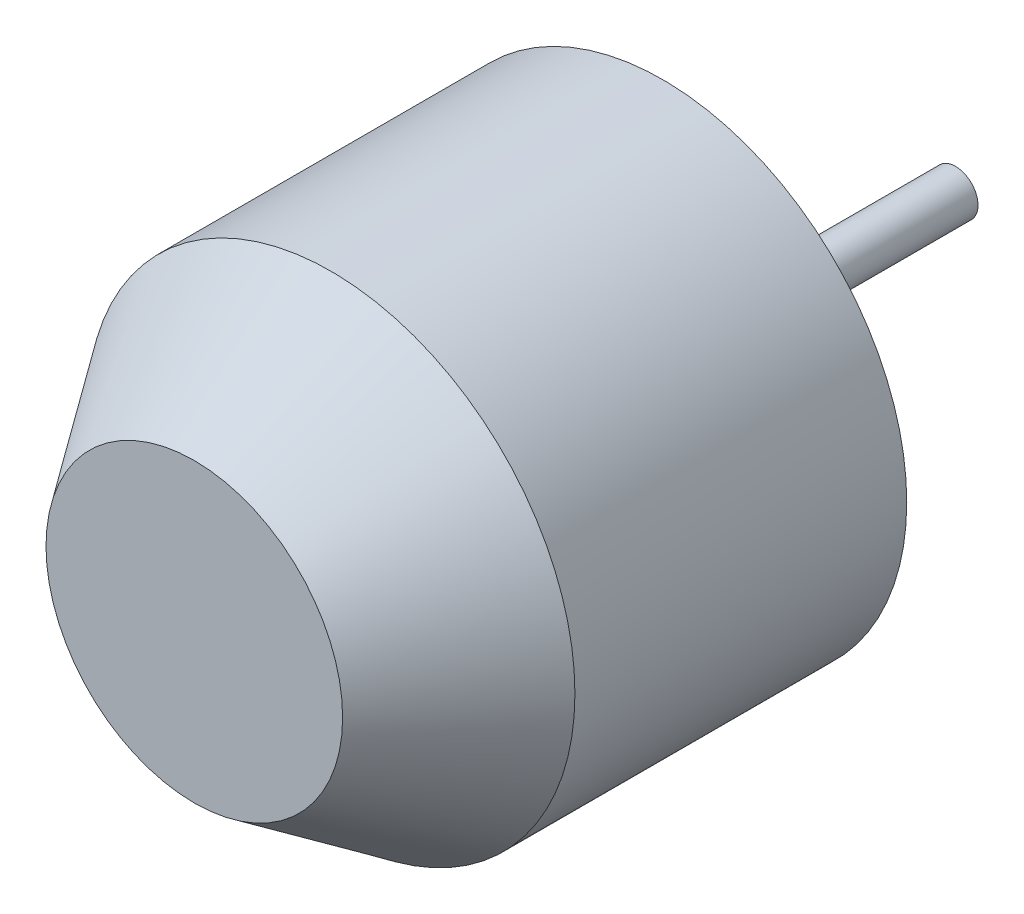
from build123d import *

# Parameters (mm, degrees)
ESQUISSE1_R             = 12.5
BOSS_EXTRU_1_DEPTH      = 17
ESQUISSE2_R             = 12.5
BOSS_EXTRU_2_DEPTH      = 7
BOSS_EXTRU_2_TAPER      = 35
ESQUISSE3_R             = 1.5
ENL_V_MAT_EXTRU_1_DEPTH = 10
CONG_1_SIZE             = 0.5
ESQUISSE4_R             = 3.5
BOSS_EXTRU_3_DEPTH      = 2
ESQUISSE5_R             = 1.15
BOSS_EXTRU_4_DEPTH      = 13


with BuildPart() as part:
    # Esquisse1 → Boss.-Extru.1 (new body)
    with BuildSketch(Plane.XY):
        Circle(ESQUISSE1_R)
    extrude(amount=BOSS_EXTRU_1_DEPTH)

    # Esquisse2 → Boss.-Extru.2 (add)
    with BuildSketch(Plane.XY.offset(17)):
        Circle(ESQUISSE2_R)
    extrude(amount=BOSS_EXTRU_2_DEPTH, taper=BOSS_EXTRU_2_TAPER)

    # Esquisse3 → Enlèv. mat.-Extru.1 (cut)
    with BuildSketch(Plane(origin=(0, 0, 0), x_dir=(-1, 0, 0), z_dir=(0, 0, -1))):
        with Locations((-8, 0)):
            Circle(ESQUISSE3_R)
        with Locations((8, 0)):
            Circle(ESQUISSE3_R)
    extrude(amount=-ENL_V_MAT_EXTRU_1_DEPTH, mode=Mode.SUBTRACT)

    # Congé1
    # a fillet whose section is not a circle: 0.5 mm, written as the material it takes off along each edge
    with BuildSketch(Plane(origin=(-8, 0, 0), x_dir=(-1, 0, 0), z_dir=(0, -1, 0))) as cong_1_piece_1:
        with BuildLine():
            Bezier((1.5 + CONG_1_SIZE, 0), (1.5, 0), (1.5, -CONG_1_SIZE), weights=[1, 0.035355339, 1])
            Line((1.5, -CONG_1_SIZE), (1.5, 0))
            Line((1.5, 0), (1.5 + CONG_1_SIZE, 0))
        make_face()
    revolve(axis=Axis((-8, 0, 0), (0, 0, -1)), mode=Mode.SUBTRACT)
    with BuildSketch(Plane(origin=(8, 0, 0), x_dir=(-1, 0, 0), z_dir=(0, -1, 0))) as cong_1_piece_2:
        with BuildLine():
            Bezier((1.5 + CONG_1_SIZE, 0), (1.5, 0), (1.5, -CONG_1_SIZE), weights=[1, 0.035355339, 1])
            Line((1.5, -CONG_1_SIZE), (1.5, 0))
            Line((1.5, 0), (1.5 + CONG_1_SIZE, 0))
        make_face()
    revolve(axis=Axis((8, 0, 0), (0, 0, -1)), mode=Mode.SUBTRACT)

    # Esquisse4 → Boss.-Extru.3 (add)
    with BuildSketch(Plane(origin=(0, 0, 0), x_dir=(-1, 0, 0), z_dir=(0, 0, -1))):
        with Locations(Location((0, 0, 0), (0, 0, 180))):
            Circle(ESQUISSE4_R)
    extrude(amount=BOSS_EXTRU_3_DEPTH)

    # Esquisse5 → Boss.-Extru.4 (add)
    with BuildSketch(Plane(origin=(0, 0, -2), x_dir=(-1, 0, 0), z_dir=(0, 0, -1))):
        with Locations(Location((0, 0, 0), (0, 0, 180))):
            Circle(ESQUISSE5_R)
    extrude(amount=BOSS_EXTRU_4_DEPTH)


solid = part.part
